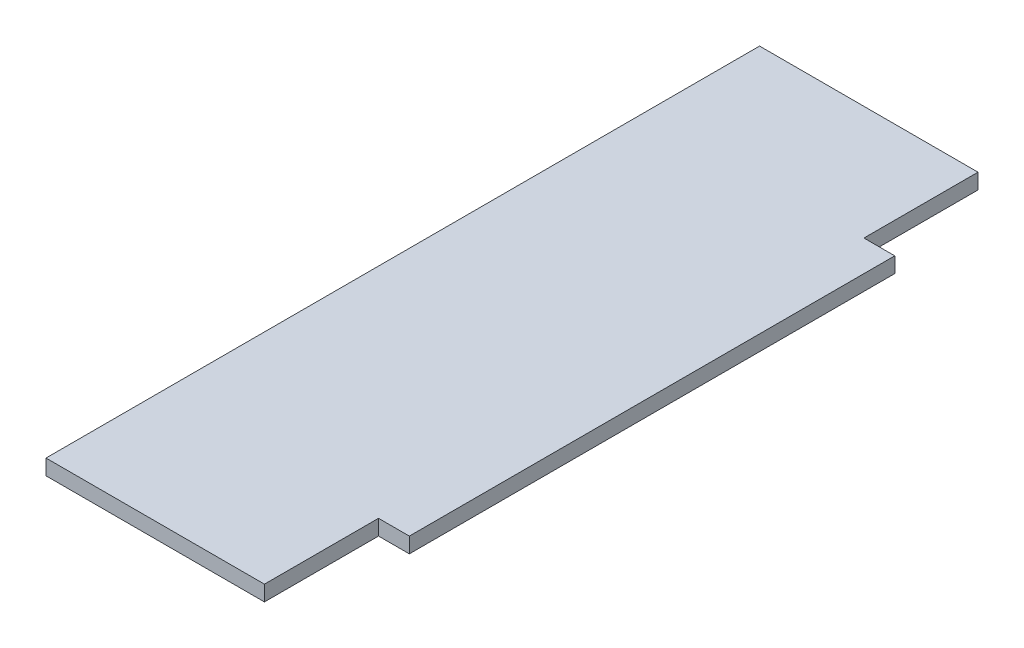
from build123d import *

# Parameters (mm, degrees)
BOSS_EXTRUDE1_DEPTH = 3.175


with BuildPart() as part:
    # Sketch1 → Boss-Extrude1 (new body)
    with BuildSketch(Plane(origin=(0, 0, 0), x_dir=(1, 0, 0), z_dir=(0, 1, 0))):
        Polygon((22.5, 23.5), (-22.5, 23.5), (-22.5, 0), (-22.5, -100), (-22.5, -123.5), (22.5, -123.5), (22.5, -100), (28.85, -100), (28.85, 0), (22.5, 0), align=None)
    extrude(amount=BOSS_EXTRUDE1_DEPTH)


solid = part.part
